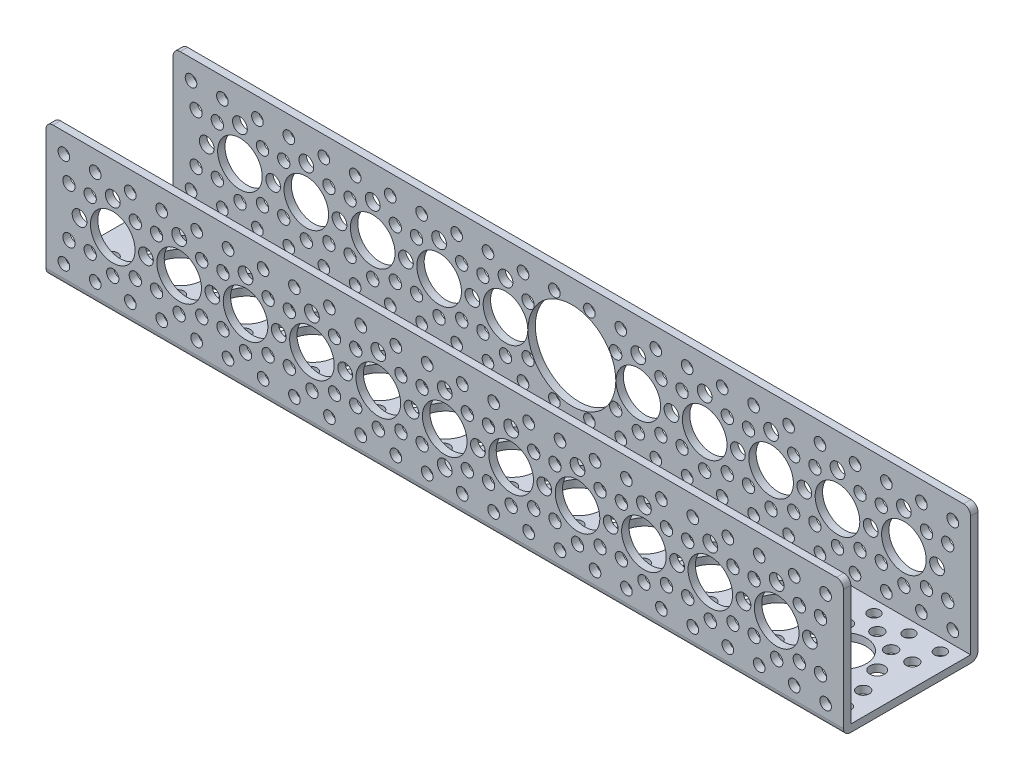
from build123d import *

# Parameters (mm, degrees)
SKETCH_1_W          = 227
SKETCH_1_H          = 38.3
EXTRUDE_1_DEPTH     = 38.3
SHELL_1_T           = -2.1
FILLET_1_R          = 2
SKETCH_2_R          = 6.35
SKETCH_2_R_2        = 1.75
SKETCH_2_R_3        = 2.1
SKETCH_2_R_4        = 1.654351132
CUT_EXTRUDE_1_DEPTH = 2.1
SKETCH_4_R          = 6.35
SKETCH_4_R_2        = 2.1
SKETCH_4_R_3        = 1.654351132
SKETCH_4_R_4        = 1.75
CUT_EXTRUDE_3_DEPTH = 38.3
CUT_EXTRUDE_4_REACH = 127.762
SKETCH_5_R          = 12.5


with BuildPart() as part:
    # 草图1 → 凸台-拉伸1 (new body)
    with BuildSketch(Plane(origin=(0, 0, 0), x_dir=(1, 0, 0), z_dir=(0, 1, 0))):
        Rectangle(SKETCH_1_W, SKETCH_1_H)
    extrude(amount=EXTRUDE_1_DEPTH)

    # 抽壳1
    shell_1_openings = [part.faces().sort_by_distance(p)[0] for p in [
        (0, 38.3, 0),
        (-113.5, 19.15, 0),
        (113.5, 19.15, 0),
    ]]
    offset(amount=SHELL_1_T, openings=shell_1_openings, kind=Kind.INTERSECTION)

    # 圆角1
    fillet_1_edges = [part.edges().sort_by_distance(p)[0] for p in [
        (-113.5, 38.3, -18.1),
        (113.5, 38.3, -18.1),
        (-113.5, 38.3, 18.1),
        (113.5, 38.3, 18.1),
        (0, 0, 19.15),
        (0, 0, -19.15),
    ]]
    fillet(fillet_1_edges, radius=FILLET_1_R)

    # 草图2 → 切除-拉伸1 (cut)
    with BuildSketch(Plane.XZ):
        with Locations(Location((0, 0, 0), (0, 0, 270))):
            Circle(SKETCH_2_R)
        with Locations(Location((18.9, 0, 0), (0, 0, 270))):
            Circle(SKETCH_2_R)
        with Locations(Location((37.8, 0, 0), (0, 0, 270))):
            Circle(SKETCH_2_R)
        with Locations(Location((56.7, 0, 0), (0, 0, 270))):
            Circle(SKETCH_2_R)
        with Locations(Location((75.6, 0, 0), (0, 0, 270))):
            Circle(SKETCH_2_R)
        with Locations(Location((94.5, 0, 0), (0, 0, 270))):
            Circle(SKETCH_2_R)
        with Locations(Location((-94.5, 0, 0), (0, 0, 90))):
            Circle(SKETCH_2_R)
        with Locations(Location((-75.6, 0, 0), (0, 0, 90))):
            Circle(SKETCH_2_R)
        with Locations(Location((-56.7, 0, 0), (0, 0, 90))):
            Circle(SKETCH_2_R)
        with Locations(Location((-37.8, 0, 0), (0, 0, 90))):
            Circle(SKETCH_2_R)
        with Locations(Location((-18.9, 0, 0), (0, 0, 90))):
            Circle(SKETCH_2_R)
        with Locations(Location((0, 9.5, 0), (0, 0, 270))):
            Circle(SKETCH_2_R_2)
        with Locations(Location((9.45, 0, 0), (0, 0, 270))):
            Circle(SKETCH_2_R_3)
        with Locations(Location((4.986031124, 13.519354058, 0), (0, 0, 270))):
            Circle(SKETCH_2_R_4)
        with Locations(Location((6.428920525, 6.994210526, 0), (0, 0, 270))):
            Circle(SKETCH_2_R_2)
        with Locations(Location((-9.45, 0, 0), (0, 0, 90))):
            Circle(SKETCH_2_R_3)
        with Locations(Location((-6.428920525, 6.994210526, 0), (0, 0, 90))):
            Circle(SKETCH_2_R_2)
        with Locations(Location((-4.986031124, 13.519354058, 0), (0, 0, 90))):
            Circle(SKETCH_2_R_4)
        with Locations(Location((6.428920525, -6.994210526, 0), (0, 0, 90))):
            Circle(SKETCH_2_R_2)
        with Locations(Location((4.986031124, -13.519354058, 0), (0, 0, 90))):
            Circle(SKETCH_2_R_4)
        with Locations(Location((0, -9.5, 0), (0, 0, 90))):
            Circle(SKETCH_2_R_2)
        with Locations(Location((-4.986031124, -13.519354058, 0), (0, 0, 270))):
            Circle(SKETCH_2_R_4)
        with Locations(Location((-6.428920525, -6.994210526, 0), (0, 0, 270))):
            Circle(SKETCH_2_R_2)
        with Locations(Location((12.471079475, 6.994210526, 0), (0, 0, 90))):
            Circle(SKETCH_2_R_2)
        with Locations(Location((13.913968876, 13.519354058, 0), (0, 0, 90))):
            Circle(SKETCH_2_R_4)
        with Locations(Location((12.471079475, -6.994210526, 0), (0, 0, 270))):
            Circle(SKETCH_2_R_2)
        with Locations(Location((13.913968876, -13.519354058, 0), (0, 0, 270))):
            Circle(SKETCH_2_R_4)
        with Locations(Location((18.9, -9.5, 0), (0, 0, 90))):
            Circle(SKETCH_2_R_2)
        with Locations(Location((23.886031124, -13.519354058, 0), (0, 0, 90))):
            Circle(SKETCH_2_R_4)
        with Locations(Location((25.328920525, -6.994210526, 0), (0, 0, 90))):
            Circle(SKETCH_2_R_2)
        with Locations(Location((28.35, 0, 0), (0, 0, 270))):
            Circle(SKETCH_2_R_3)
        with Locations(Location((25.328920525, 6.994210526, 0), (0, 0, 270))):
            Circle(SKETCH_2_R_2)
        with Locations(Location((18.9, 9.5, 0), (0, 0, 270))):
            Circle(SKETCH_2_R_2)
        with Locations(Location((23.886031124, 13.519354058, 0), (0, 0, 270))):
            Circle(SKETCH_2_R_4)
        with Locations(Location((31.371079475, 6.994210526, 0), (0, 0, 90))):
            Circle(SKETCH_2_R_2)
        with Locations(Location((32.813968876, 13.519354058, 0), (0, 0, 90))):
            Circle(SKETCH_2_R_4)
        with Locations(Location((31.371079475, -6.994210526, 0), (0, 0, 270))):
            Circle(SKETCH_2_R_2)
        with Locations(Location((32.813968876, -13.519354058, 0), (0, 0, 270))):
            Circle(SKETCH_2_R_4)
        with Locations(Location((37.8, -9.5, 0), (0, 0, 90))):
            Circle(SKETCH_2_R_2)
        with Locations(Location((42.786031124, -13.519354058, 0), (0, 0, 90))):
            Circle(SKETCH_2_R_4)
        with Locations(Location((44.228920525, -6.994210526, 0), (0, 0, 90))):
            Circle(SKETCH_2_R_2)
        with Locations(Location((47.25, 0, 0), (0, 0, 270))):
            Circle(SKETCH_2_R_3)
        with Locations(Location((44.228920525, 6.994210526, 0), (0, 0, 270))):
            Circle(SKETCH_2_R_2)
        with Locations(Location((37.8, 9.5, 0), (0, 0, 270))):
            Circle(SKETCH_2_R_2)
        with Locations(Location((42.786031124, 13.519354058, 0), (0, 0, 270))):
            Circle(SKETCH_2_R_4)
        with Locations(Location((50.271079475, 6.994210526, 0), (0, 0, 90))):
            Circle(SKETCH_2_R_2)
        with Locations(Location((51.713968876, 13.519354058, 0), (0, 0, 90))):
            Circle(SKETCH_2_R_4)
        with Locations(Location((50.271079475, -6.994210526, 0), (0, 0, 270))):
            Circle(SKETCH_2_R_2)
        with Locations(Location((51.713968876, -13.519354058, 0), (0, 0, 270))):
            Circle(SKETCH_2_R_4)
        with Locations(Location((56.7, -9.5, 0), (0, 0, 90))):
            Circle(SKETCH_2_R_2)
        with Locations(Location((61.686031124, -13.519354058, 0), (0, 0, 90))):
            Circle(SKETCH_2_R_4)
        with Locations(Location((63.128920525, -6.994210526, 0), (0, 0, 90))):
            Circle(SKETCH_2_R_2)
        with Locations(Location((66.15, 0, 0), (0, 0, 270))):
            Circle(SKETCH_2_R_3)
        with Locations(Location((63.128920525, 6.994210526, 0), (0, 0, 270))):
            Circle(SKETCH_2_R_2)
        with Locations(Location((56.7, 9.5, 0), (0, 0, 270))):
            Circle(SKETCH_2_R_2)
        with Locations(Location((61.686031124, 13.519354058, 0), (0, 0, 270))):
            Circle(SKETCH_2_R_4)
        with Locations(Location((69.171079475, 6.994210526, 0), (0, 0, 90))):
            Circle(SKETCH_2_R_2)
        with Locations(Location((70.613968876, 13.519354058, 0), (0, 0, 90))):
            Circle(SKETCH_2_R_4)
        with Locations(Location((69.171079475, -6.994210526, 0), (0, 0, 270))):
            Circle(SKETCH_2_R_2)
        with Locations(Location((70.613968876, -13.519354058, 0), (0, 0, 270))):
            Circle(SKETCH_2_R_4)
        with Locations(Location((75.6, -9.5, 0), (0, 0, 90))):
            Circle(SKETCH_2_R_2)
        with Locations(Location((80.586031124, -13.519354058, 0), (0, 0, 90))):
            Circle(SKETCH_2_R_4)
        with Locations(Location((82.028920525, -6.994210526, 0), (0, 0, 90))):
            Circle(SKETCH_2_R_2)
        with Locations(Location((85.05, 0, 0), (0, 0, 270))):
            Circle(SKETCH_2_R_3)
        with Locations(Location((82.028920525, 6.994210526, 0), (0, 0, 270))):
            Circle(SKETCH_2_R_2)
        with Locations(Location((75.6, 9.5, 0), (0, 0, 270))):
            Circle(SKETCH_2_R_2)
        with Locations(Location((80.586031124, 13.519354058, 0), (0, 0, 270))):
            Circle(SKETCH_2_R_4)
        with Locations(Location((88.071079475, 6.994210526, 0), (0, 0, 90))):
            Circle(SKETCH_2_R_2)
        with Locations(Location((89.513968876, 13.519354058, 0), (0, 0, 90))):
            Circle(SKETCH_2_R_4)
        with Locations(Location((88.071079475, -6.994210526, 0), (0, 0, 270))):
            Circle(SKETCH_2_R_2)
        with Locations(Location((89.513968876, -13.519354058, 0), (0, 0, 270))):
            Circle(SKETCH_2_R_4)
        with Locations(Location((94.5, -9.5, 0), (0, 0, 90))):
            Circle(SKETCH_2_R_2)
        with Locations(Location((99.486031124, -13.519354058, 0), (0, 0, 90))):
            Circle(SKETCH_2_R_4)
        with Locations(Location((100.928920525, -6.994210526, 0), (0, 0, 90))):
            Circle(SKETCH_2_R_2)
        with Locations(Location((103.95, 0, 0), (0, 0, 270))):
            Circle(SKETCH_2_R_3)
        with Locations(Location((100.928920525, 6.994210526, 0), (0, 0, 270))):
            Circle(SKETCH_2_R_2)
        with Locations(Location((94.5, 9.5, 0), (0, 0, 270))):
            Circle(SKETCH_2_R_2)
        with Locations(Location((99.486031124, 13.519354058, 0), (0, 0, 270))):
            Circle(SKETCH_2_R_4)
        with Locations(Location((108.413968876, -13.519354058, 0), (0, 0, 270))):
            Circle(SKETCH_2_R_4)
        with Locations(Location((106.971079475, -6.994210526, 0), (0, 0, 270))):
            Circle(SKETCH_2_R_2)
        with Locations(Location((106.971079475, 6.994210526, 0), (0, 0, 90))):
            Circle(SKETCH_2_R_2)
        with Locations(Location((108.413968876, 13.519354058, 0), (0, 0, 90))):
            Circle(SKETCH_2_R_4)
        with Locations(Location((-108.413968876, 13.519354058, 0), (0, 0, 270))):
            Circle(SKETCH_2_R_4)
        with Locations(Location((-106.971079475, 6.994210526, 0), (0, 0, 270))):
            Circle(SKETCH_2_R_2)
        with Locations(Location((-106.971079475, -6.994210526, 0), (0, 0, 90))):
            Circle(SKETCH_2_R_2)
        with Locations(Location((-108.413968876, -13.519354058, 0), (0, 0, 90))):
            Circle(SKETCH_2_R_4)
        with Locations(Location((-99.486031124, 13.519354058, 0), (0, 0, 90))):
            Circle(SKETCH_2_R_4)
        with Locations(Location((-94.5, 9.5, 0), (0, 0, 90))):
            Circle(SKETCH_2_R_2)
        with Locations(Location((-100.928920525, 6.994210526, 0), (0, 0, 90))):
            Circle(SKETCH_2_R_2)
        with Locations(Location((-103.95, 0, 0), (0, 0, 90))):
            Circle(SKETCH_2_R_3)
        with Locations(Location((-100.928920525, -6.994210526, 0), (0, 0, 270))):
            Circle(SKETCH_2_R_2)
        with Locations(Location((-99.486031124, -13.519354058, 0), (0, 0, 270))):
            Circle(SKETCH_2_R_4)
        with Locations(Location((-94.5, -9.5, 0), (0, 0, 270))):
            Circle(SKETCH_2_R_2)
        with Locations(Location((-89.513968876, -13.519354058, 0), (0, 0, 90))):
            Circle(SKETCH_2_R_4)
        with Locations(Location((-88.071079475, -6.994210526, 0), (0, 0, 90))):
            Circle(SKETCH_2_R_2)
        with Locations(Location((-89.513968876, 13.519354058, 0), (0, 0, 270))):
            Circle(SKETCH_2_R_4)
        with Locations(Location((-88.071079475, 6.994210526, 0), (0, 0, 270))):
            Circle(SKETCH_2_R_2)
        with Locations(Location((-85.05, 0, 0), (0, 0, 270))):
            Circle(SKETCH_2_R_3)
        with Locations(Location((-80.586031124, 13.519354058, 0), (0, 0, 90))):
            Circle(SKETCH_2_R_4)
        with Locations(Location((-75.6, 9.5, 0), (0, 0, 90))):
            Circle(SKETCH_2_R_2)
        with Locations(Location((-82.028920525, 6.994210526, 0), (0, 0, 90))):
            Circle(SKETCH_2_R_2)
        with Locations(Location((-82.028920525, -6.994210526, 0), (0, 0, 270))):
            Circle(SKETCH_2_R_2)
        with Locations(Location((-80.586031124, -13.519354058, 0), (0, 0, 270))):
            Circle(SKETCH_2_R_4)
        with Locations(Location((-75.6, -9.5, 0), (0, 0, 270))):
            Circle(SKETCH_2_R_2)
        with Locations(Location((-70.613968876, -13.519354058, 0), (0, 0, 90))):
            Circle(SKETCH_2_R_4)
        with Locations(Location((-69.171079475, -6.994210526, 0), (0, 0, 90))):
            Circle(SKETCH_2_R_2)
        with Locations(Location((-70.613968876, 13.519354058, 0), (0, 0, 270))):
            Circle(SKETCH_2_R_4)
        with Locations(Location((-69.171079475, 6.994210526, 0), (0, 0, 270))):
            Circle(SKETCH_2_R_2)
        with Locations(Location((-66.15, 0, 0), (0, 0, 270))):
            Circle(SKETCH_2_R_3)
        with Locations(Location((-61.686031124, 13.519354058, 0), (0, 0, 90))):
            Circle(SKETCH_2_R_4)
        with Locations(Location((-56.7, 9.5, 0), (0, 0, 90))):
            Circle(SKETCH_2_R_2)
        with Locations(Location((-63.128920525, 6.994210526, 0), (0, 0, 90))):
            Circle(SKETCH_2_R_2)
        with Locations(Location((-63.128920525, -6.994210526, 0), (0, 0, 270))):
            Circle(SKETCH_2_R_2)
        with Locations(Location((-61.686031124, -13.519354058, 0), (0, 0, 270))):
            Circle(SKETCH_2_R_4)
        with Locations(Location((-56.7, -9.5, 0), (0, 0, 270))):
            Circle(SKETCH_2_R_2)
        with Locations(Location((-51.713968876, -13.519354058, 0), (0, 0, 90))):
            Circle(SKETCH_2_R_4)
        with Locations(Location((-50.271079475, -6.994210526, 0), (0, 0, 90))):
            Circle(SKETCH_2_R_2)
        with Locations(Location((-51.713968876, 13.519354058, 0), (0, 0, 270))):
            Circle(SKETCH_2_R_4)
        with Locations(Location((-50.271079475, 6.994210526, 0), (0, 0, 270))):
            Circle(SKETCH_2_R_2)
        with Locations(Location((-47.25, 0, 0), (0, 0, 270))):
            Circle(SKETCH_2_R_3)
        with Locations(Location((-42.786031124, 13.519354058, 0), (0, 0, 90))):
            Circle(SKETCH_2_R_4)
        with Locations(Location((-37.8, 9.5, 0), (0, 0, 90))):
            Circle(SKETCH_2_R_2)
        with Locations(Location((-44.228920525, 6.994210526, 0), (0, 0, 90))):
            Circle(SKETCH_2_R_2)
        with Locations(Location((-44.228920525, -6.994210526, 0), (0, 0, 270))):
            Circle(SKETCH_2_R_2)
        with Locations(Location((-42.786031124, -13.519354058, 0), (0, 0, 270))):
            Circle(SKETCH_2_R_4)
        with Locations(Location((-37.8, -9.5, 0), (0, 0, 270))):
            Circle(SKETCH_2_R_2)
        with Locations(Location((-32.813968876, -13.519354058, 0), (0, 0, 90))):
            Circle(SKETCH_2_R_4)
        with Locations(Location((-31.371079475, -6.994210526, 0), (0, 0, 90))):
            Circle(SKETCH_2_R_2)
        with Locations(Location((-32.813968876, 13.519354058, 0), (0, 0, 270))):
            Circle(SKETCH_2_R_4)
        with Locations(Location((-31.371079475, 6.994210526, 0), (0, 0, 270))):
            Circle(SKETCH_2_R_2)
        with Locations(Location((-28.35, 0, 0), (0, 0, 270))):
            Circle(SKETCH_2_R_3)
        with Locations(Location((-23.886031124, 13.519354058, 0), (0, 0, 90))):
            Circle(SKETCH_2_R_4)
        with Locations(Location((-18.9, 9.5, 0), (0, 0, 90))):
            Circle(SKETCH_2_R_2)
        with Locations(Location((-25.328920525, 6.994210526, 0), (0, 0, 90))):
            Circle(SKETCH_2_R_2)
        with Locations(Location((-25.328920525, -6.994210526, 0), (0, 0, 270))):
            Circle(SKETCH_2_R_2)
        with Locations(Location((-23.886031124, -13.519354058, 0), (0, 0, 270))):
            Circle(SKETCH_2_R_4)
        with Locations(Location((-18.9, -9.5, 0), (0, 0, 270))):
            Circle(SKETCH_2_R_2)
        with Locations(Location((-13.913968876, -13.519354058, 0), (0, 0, 90))):
            Circle(SKETCH_2_R_4)
        with Locations(Location((-12.471079475, -6.994210526, 0), (0, 0, 90))):
            Circle(SKETCH_2_R_2)
        with Locations(Location((-13.913968876, 13.519354058, 0), (0, 0, 270))):
            Circle(SKETCH_2_R_4)
        with Locations(Location((-12.471079475, 6.994210526, 0), (0, 0, 270))):
            Circle(SKETCH_2_R_2)
    extrude(amount=-CUT_EXTRUDE_1_DEPTH, mode=Mode.SUBTRACT)

    # 草图4 → 切除-拉伸3 (cut)
    with BuildSketch(Plane.XY.offset(19.15)):
        with Locations((0, 19.15)):
            Circle(SKETCH_4_R)
        with Locations((18.9, 19.15)):
            Circle(SKETCH_4_R)
        with Locations((37.8, 19.15)):
            Circle(SKETCH_4_R)
        with Locations((56.7, 19.15)):
            Circle(SKETCH_4_R)
        with Locations((75.6, 19.15)):
            Circle(SKETCH_4_R)
        with Locations((94.5, 19.15)):
            Circle(SKETCH_4_R)
        with Locations(Location((-94.5, 19.15, 0), (0, 0, 180))):
            Circle(SKETCH_4_R)
        with Locations(Location((-75.6, 19.15, 0), (0, 0, 180))):
            Circle(SKETCH_4_R)
        with Locations(Location((-56.7, 19.15, 0), (0, 0, 180))):
            Circle(SKETCH_4_R)
        with Locations(Location((-37.8, 19.15, 0), (0, 0, 180))):
            Circle(SKETCH_4_R)
        with Locations(Location((-18.9, 19.15, 0), (0, 0, 180))):
            Circle(SKETCH_4_R)
        with Locations((0, 28.65)):
            Circle(SKETCH_4_R_2)
        with Locations((9.45, 19.15)):
            Circle(SKETCH_4_R_2)
        with Locations((4.986031124, 32.669354058)):
            Circle(SKETCH_4_R_3)
        with Locations((6.428920525, 26.144210526)):
            Circle(SKETCH_4_R_4)
        with Locations(Location((-9.45, 19.15, 0), (0, 0, 180))):
            Circle(SKETCH_4_R_2)
        with Locations(Location((-6.428920525, 26.144210526, 0), (0, 0, 180))):
            Circle(SKETCH_4_R_4)
        with Locations(Location((-4.986031124, 32.669354058, 0), (0, 0, 180))):
            Circle(SKETCH_4_R_3)
        with Locations(Location((6.428920525, 12.155789474, 0), (0, 0, 180))):
            Circle(SKETCH_4_R_4)
        with Locations(Location((4.986031124, 5.630645942, 0), (0, 0, 180))):
            Circle(SKETCH_4_R_3)
        with Locations(Location((0, 9.65, 0), (0, 0, 180))):
            Circle(SKETCH_4_R_2)
        with Locations((-4.986031124, 5.630645942)):
            Circle(SKETCH_4_R_3)
        with Locations((-6.428920525, 12.155789474)):
            Circle(SKETCH_4_R_4)
        with Locations(Location((12.471079475, 26.144210526, 0), (0, 0, 180))):
            Circle(SKETCH_4_R_4)
        with Locations(Location((13.913968876, 32.669354058, 0), (0, 0, 180))):
            Circle(SKETCH_4_R_3)
        with Locations((12.471079475, 12.155789474)):
            Circle(SKETCH_4_R_4)
        with Locations((13.913968876, 5.630645942)):
            Circle(SKETCH_4_R_3)
        with Locations(Location((18.9, 9.65, 0), (0, 0, 180))):
            Circle(SKETCH_4_R_4)
        with Locations(Location((23.886031124, 5.630645942, 0), (0, 0, 180))):
            Circle(SKETCH_4_R_3)
        with Locations(Location((25.328920525, 12.155789474, 0), (0, 0, 180))):
            Circle(SKETCH_4_R_4)
        with Locations((28.35, 19.15)):
            Circle(SKETCH_4_R_2)
        with Locations((25.328920525, 26.144210526)):
            Circle(SKETCH_4_R_4)
        with Locations((18.9, 28.65)):
            Circle(SKETCH_4_R_2)
        with Locations((23.886031124, 32.669354058)):
            Circle(SKETCH_4_R_3)
        with Locations(Location((31.371079475, 26.144210526, 0), (0, 0, 180))):
            Circle(SKETCH_4_R_4)
        with Locations(Location((32.813968876, 32.669354058, 0), (0, 0, 180))):
            Circle(SKETCH_4_R_3)
        with Locations((31.371079475, 12.155789474)):
            Circle(SKETCH_4_R_4)
        with Locations((32.813968876, 5.630645942)):
            Circle(SKETCH_4_R_3)
        with Locations(Location((37.8, 9.65, 0), (0, 0, 180))):
            Circle(SKETCH_4_R_4)
        with Locations(Location((42.786031124, 5.630645942, 0), (0, 0, 180))):
            Circle(SKETCH_4_R_3)
        with Locations(Location((44.228920525, 12.155789474, 0), (0, 0, 180))):
            Circle(SKETCH_4_R_4)
        with Locations((47.25, 19.15)):
            Circle(SKETCH_4_R_2)
        with Locations((44.228920525, 26.144210526)):
            Circle(SKETCH_4_R_4)
        with Locations((37.8, 28.65)):
            Circle(SKETCH_4_R_2)
        with Locations((42.786031124, 32.669354058)):
            Circle(SKETCH_4_R_3)
        with Locations(Location((50.271079475, 26.144210526, 0), (0, 0, 180))):
            Circle(SKETCH_4_R_4)
        with Locations(Location((51.713968876, 32.669354058, 0), (0, 0, 180))):
            Circle(SKETCH_4_R_3)
        with Locations((50.271079475, 12.155789474)):
            Circle(SKETCH_4_R_4)
        with Locations((51.713968876, 5.630645942)):
            Circle(SKETCH_4_R_3)
        with Locations(Location((56.7, 9.65, 0), (0, 0, 180))):
            Circle(SKETCH_4_R_4)
        with Locations(Location((61.686031124, 5.630645942, 0), (0, 0, 180))):
            Circle(SKETCH_4_R_3)
        with Locations(Location((63.128920525, 12.155789474, 0), (0, 0, 180))):
            Circle(SKETCH_4_R_4)
        with Locations((66.15, 19.15)):
            Circle(SKETCH_4_R_2)
        with Locations((63.128920525, 26.144210526)):
            Circle(SKETCH_4_R_4)
        with Locations((56.7, 28.65)):
            Circle(SKETCH_4_R_2)
        with Locations((61.686031124, 32.669354058)):
            Circle(SKETCH_4_R_3)
        with Locations(Location((69.171079475, 26.144210526, 0), (0, 0, 180))):
            Circle(SKETCH_4_R_4)
        with Locations(Location((70.613968876, 32.669354058, 0), (0, 0, 180))):
            Circle(SKETCH_4_R_3)
        with Locations((69.171079475, 12.155789474)):
            Circle(SKETCH_4_R_4)
        with Locations((70.613968876, 5.630645942)):
            Circle(SKETCH_4_R_3)
        with Locations(Location((75.6, 9.65, 0), (0, 0, 180))):
            Circle(SKETCH_4_R_4)
        with Locations(Location((80.586031124, 5.630645942, 0), (0, 0, 180))):
            Circle(SKETCH_4_R_3)
        with Locations(Location((82.028920525, 12.155789474, 0), (0, 0, 180))):
            Circle(SKETCH_4_R_4)
        with Locations((85.05, 19.15)):
            Circle(SKETCH_4_R_2)
        with Locations((82.028920525, 26.144210526)):
            Circle(SKETCH_4_R_4)
        with Locations((75.6, 28.65)):
            Circle(SKETCH_4_R_2)
        with Locations((80.586031124, 32.669354058)):
            Circle(SKETCH_4_R_3)
        with Locations(Location((88.071079475, 26.144210526, 0), (0, 0, 180))):
            Circle(SKETCH_4_R_4)
        with Locations(Location((89.513968876, 32.669354058, 0), (0, 0, 180))):
            Circle(SKETCH_4_R_3)
        with Locations((88.071079475, 12.155789474)):
            Circle(SKETCH_4_R_4)
        with Locations((89.513968876, 5.630645942)):
            Circle(SKETCH_4_R_3)
        with Locations(Location((94.5, 9.65, 0), (0, 0, 180))):
            Circle(SKETCH_4_R_4)
        with Locations(Location((99.486031124, 5.630645942, 0), (0, 0, 180))):
            Circle(SKETCH_4_R_3)
        with Locations(Location((100.928920525, 12.155789474, 0), (0, 0, 180))):
            Circle(SKETCH_4_R_4)
        with Locations((103.95, 19.15)):
            Circle(SKETCH_4_R_2)
        with Locations((100.928920525, 26.144210526)):
            Circle(SKETCH_4_R_4)
        with Locations((94.5, 28.65)):
            Circle(SKETCH_4_R_2)
        with Locations((99.486031124, 32.669354058)):
            Circle(SKETCH_4_R_3)
        with Locations((108.413968876, 5.630645942)):
            Circle(SKETCH_4_R_3)
        with Locations((106.971079475, 12.155789474)):
            Circle(SKETCH_4_R_4)
        with Locations(Location((106.971079475, 26.144210526, 0), (0, 0, 180))):
            Circle(SKETCH_4_R_4)
        with Locations(Location((108.413968876, 32.669354058, 0), (0, 0, 180))):
            Circle(SKETCH_4_R_3)
        with Locations((-108.413968876, 32.669354058)):
            Circle(SKETCH_4_R_3)
        with Locations((-106.971079475, 26.144210526)):
            Circle(SKETCH_4_R_4)
        with Locations(Location((-106.971079475, 12.155789474, 0), (0, 0, 180))):
            Circle(SKETCH_4_R_4)
        with Locations(Location((-108.413968876, 5.630645942, 0), (0, 0, 180))):
            Circle(SKETCH_4_R_3)
        with Locations(Location((-99.486031124, 32.669354058, 0), (0, 0, 180))):
            Circle(SKETCH_4_R_3)
        with Locations(Location((-94.5, 28.65, 0), (0, 0, 180))):
            Circle(SKETCH_4_R_2)
        with Locations(Location((-100.928920525, 26.144210526, 0), (0, 0, 180))):
            Circle(SKETCH_4_R_4)
        with Locations(Location((-103.95, 19.15, 0), (0, 0, 180))):
            Circle(SKETCH_4_R_2)
        with Locations((-100.928920525, 12.155789474)):
            Circle(SKETCH_4_R_4)
        with Locations((-99.486031124, 5.630645942)):
            Circle(SKETCH_4_R_3)
        with Locations((-94.5, 9.65)):
            Circle(SKETCH_4_R_4)
        with Locations(Location((-89.513968876, 5.630645942, 0), (0, 0, 180))):
            Circle(SKETCH_4_R_3)
        with Locations(Location((-88.071079475, 12.155789474, 0), (0, 0, 180))):
            Circle(SKETCH_4_R_4)
        with Locations((-89.513968876, 32.669354058)):
            Circle(SKETCH_4_R_3)
        with Locations((-88.071079475, 26.144210526)):
            Circle(SKETCH_4_R_4)
        with Locations((-85.05, 19.15)):
            Circle(SKETCH_4_R_2)
        with Locations(Location((-80.586031124, 32.669354058, 0), (0, 0, 180))):
            Circle(SKETCH_4_R_3)
        with Locations(Location((-75.6, 28.65, 0), (0, 0, 180))):
            Circle(SKETCH_4_R_2)
        with Locations(Location((-82.028920525, 26.144210526, 0), (0, 0, 180))):
            Circle(SKETCH_4_R_4)
        with Locations((-82.028920525, 12.155789474)):
            Circle(SKETCH_4_R_4)
        with Locations((-80.586031124, 5.630645942)):
            Circle(SKETCH_4_R_3)
        with Locations((-75.6, 9.65)):
            Circle(SKETCH_4_R_4)
        with Locations(Location((-70.613968876, 5.630645942, 0), (0, 0, 180))):
            Circle(SKETCH_4_R_3)
        with Locations(Location((-69.171079475, 12.155789474, 0), (0, 0, 180))):
            Circle(SKETCH_4_R_4)
        with Locations((-70.613968876, 32.669354058)):
            Circle(SKETCH_4_R_3)
        with Locations((-69.171079475, 26.144210526)):
            Circle(SKETCH_4_R_4)
        with Locations((-66.15, 19.15)):
            Circle(SKETCH_4_R_2)
        with Locations(Location((-61.686031124, 32.669354058, 0), (0, 0, 180))):
            Circle(SKETCH_4_R_3)
        with Locations(Location((-56.7, 28.65, 0), (0, 0, 180))):
            Circle(SKETCH_4_R_2)
        with Locations(Location((-63.128920525, 26.144210526, 0), (0, 0, 180))):
            Circle(SKETCH_4_R_4)
        with Locations((-63.128920525, 12.155789474)):
            Circle(SKETCH_4_R_4)
        with Locations((-61.686031124, 5.630645942)):
            Circle(SKETCH_4_R_3)
        with Locations((-56.7, 9.65)):
            Circle(SKETCH_4_R_4)
        with Locations(Location((-51.713968876, 5.630645942, 0), (0, 0, 180))):
            Circle(SKETCH_4_R_3)
        with Locations(Location((-50.271079475, 12.155789474, 0), (0, 0, 180))):
            Circle(SKETCH_4_R_4)
        with Locations((-51.713968876, 32.669354058)):
            Circle(SKETCH_4_R_3)
        with Locations((-50.271079475, 26.144210526)):
            Circle(SKETCH_4_R_4)
        with Locations((-47.25, 19.15)):
            Circle(SKETCH_4_R_2)
        with Locations(Location((-42.786031124, 32.669354058, 0), (0, 0, 180))):
            Circle(SKETCH_4_R_3)
        with Locations(Location((-37.8, 28.65, 0), (0, 0, 180))):
            Circle(SKETCH_4_R_2)
        with Locations(Location((-44.228920525, 26.144210526, 0), (0, 0, 180))):
            Circle(SKETCH_4_R_4)
        with Locations((-44.228920525, 12.155789474)):
            Circle(SKETCH_4_R_4)
        with Locations((-42.786031124, 5.630645942)):
            Circle(SKETCH_4_R_3)
        with Locations((-37.8, 9.65)):
            Circle(SKETCH_4_R_4)
        with Locations(Location((-32.813968876, 5.630645942, 0), (0, 0, 180))):
            Circle(SKETCH_4_R_3)
        with Locations(Location((-31.371079475, 12.155789474, 0), (0, 0, 180))):
            Circle(SKETCH_4_R_4)
        with Locations((-32.813968876, 32.669354058)):
            Circle(SKETCH_4_R_3)
        with Locations((-31.371079475, 26.144210526)):
            Circle(SKETCH_4_R_4)
        with Locations((-28.35, 19.15)):
            Circle(SKETCH_4_R_2)
        with Locations(Location((-23.886031124, 32.669354058, 0), (0, 0, 180))):
            Circle(SKETCH_4_R_3)
        with Locations(Location((-18.9, 28.65, 0), (0, 0, 180))):
            Circle(SKETCH_4_R_2)
        with Locations(Location((-25.328920525, 26.144210526, 0), (0, 0, 180))):
            Circle(SKETCH_4_R_4)
        with Locations((-25.328920525, 12.155789474)):
            Circle(SKETCH_4_R_4)
        with Locations((-23.886031124, 5.630645942)):
            Circle(SKETCH_4_R_3)
        with Locations((-18.9, 9.65)):
            Circle(SKETCH_4_R_4)
        with Locations(Location((-13.913968876, 5.630645942, 0), (0, 0, 180))):
            Circle(SKETCH_4_R_3)
        with Locations(Location((-12.471079475, 12.155789474, 0), (0, 0, 180))):
            Circle(SKETCH_4_R_4)
        with Locations((-13.913968876, 32.669354058)):
            Circle(SKETCH_4_R_3)
        with Locations((-12.471079475, 26.144210526)):
            Circle(SKETCH_4_R_4)
    extrude(amount=-CUT_EXTRUDE_3_DEPTH, mode=Mode.SUBTRACT)

    # 草图5 → 切除-拉伸4 (cut, up to next)
    with BuildSketch(Plane(origin=(0, 0, -19.15), x_dir=(-1, 0, 0), z_dir=(0, 0, -1)), mode=Mode.PRIVATE) as cut_extrude_4_sk1:
        with Locations((0, 19.15)):
            Circle(SKETCH_5_R)
    cut_extrude_4_tool1 = extrude(cut_extrude_4_sk1.sketch, amount=-CUT_EXTRUDE_4_REACH, mode=Mode.PRIVATE) & part.part
    add(cut_extrude_4_tool1.solids().sort_by_distance((0, 19.15, -19.15))[0], mode=Mode.SUBTRACT)


solid = part.part
